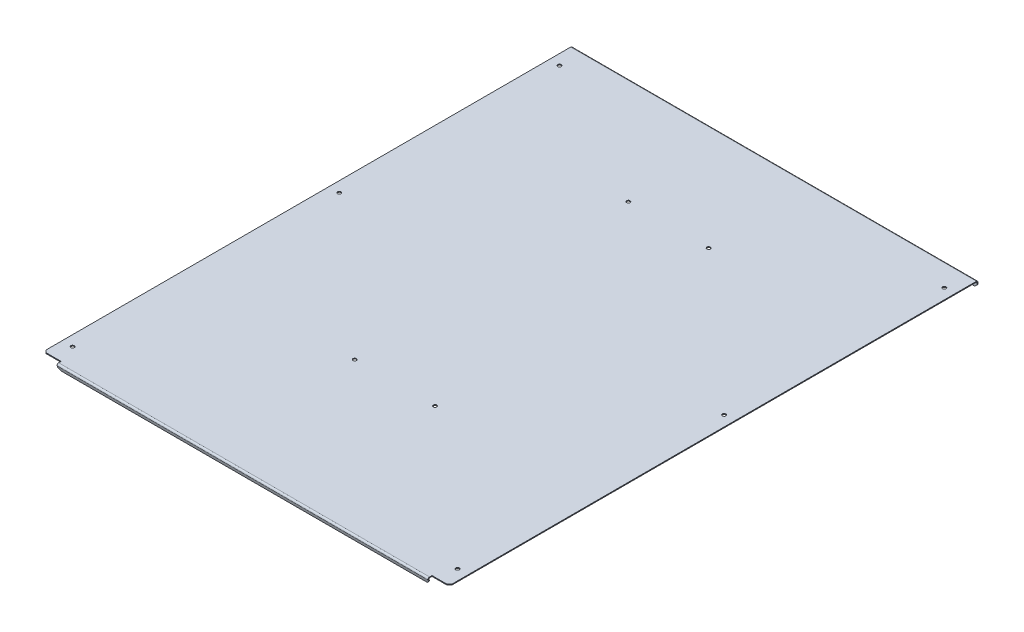
from build123d import *

# Parameters (mm, degrees)
SKETCH2_W            = 444.5
SKETCH2_H            = 584.2
BOSS_EXTRUDE1_DEPTH  = 6.35
MOVE_START           = -2.17182791
MOVE_FACE1_OUTLINE_W = 448
MOVE_FACE1_OUTLINE_H = 9
MOVE_FACE1_DEPTH     = 2.17182791
CONVERT_SOLID1_START = -222.25
CONVERT_SOLID1_DEPTH = 444.5
SKETCH7_W            = 19.05
SKETCH7_H            = 5.08
CUT_EXTRUDE1_DEPTH   = 626.080014878
SKETCH9_R            = 1.905
CUT_EXTRUDE2_DEPTH   = 1.2192
CHAMFER1_SIZE        = 2.54


# Read off the part's stored shape, not the designer's step: Move Face1, Convert-Solid1
with BuildPart() as part:
    # Sketch2 → Boss-Extrude1 (new body)
    with BuildSketch(Plane(origin=(0, 0, 0), x_dir=(1, 0, 0), z_dir=(0, 1, 0))):
        with Locations((0, 292.1)):
            Rectangle(SKETCH2_W, SKETCH2_H)
    extrude(amount=-BOSS_EXTRUDE1_DEPTH)

    # Move Face1 outline → Move Face1 (cut)
    with BuildSketch(Plane(origin=(0, 0, 0), x_dir=(1, 0, 0), z_dir=(0, 0.3420201433256691, -0.9396926207859083)).offset(MOVE_START)):
        with Locations((0, 3.5)):
            Rectangle(MOVE_FACE1_OUTLINE_W, MOVE_FACE1_OUTLINE_H)
    extrude(amount=MOVE_FACE1_DEPTH, mode=Mode.SUBTRACT)

    # Convert-Solid1 outline → Convert-Solid1 (cut)
    with BuildSketch(Plane.YZ.offset(CONVERT_SOLID1_START)):
        with BuildLine():
            Line((-6.037256781, -3.17046592), (-6.35, -2.311210988))
            Line((-6.35, -2.311210988), (-6.35, -583.2856))
            Line((-6.35, -583.2856), (-1.6764, -583.2856))
            ThreePointArc((-1.6764, -583.2856), (-1.137584633, -583.062415367), (-0.9144, -582.5236))
            Line((-0.9144, -582.5236), (-0.9144, -2.394147319))
            ThreePointArc((-0.9144, -2.394147319), (-1.239334756, -1.769953461), (-1.937019349, -1.678101541))
            Line((-1.937019349, -1.678101541), (-6.037256781, -3.17046592))
        make_face()
        with BuildLine():
            Line((0, 0), (-2.249762568, -0.818846609))
            ThreePointArc((-2.249762568, -0.818846609), (-0.714856462, -1.020920831), (0, -2.394147319))
            Line((0, -2.394147319), (0, 0))
        make_face()
        with BuildLine():
            Line((0, -584.2), (0, -582.5236))
            ThreePointArc((0, -582.5236), (-0.491006192, -583.708993808), (-1.6764, -584.2))
            Line((-1.6764, -584.2), (0, -584.2))
        make_face()
    extrude(amount=CONVERT_SOLID1_DEPTH, mode=Mode.SUBTRACT)

    # Sketch7 → Cut-Extrude1 (cut, through all)
    with BuildSketch(Plane(origin=(0, 0, 0), x_dir=(1, 0, 0), z_dir=(0, 1, 0))):
        with Locations((-212.725, 2.54)):
            Rectangle(SKETCH7_W, SKETCH7_H)
        with Locations((212.725, 2.54)):
            Rectangle(SKETCH7_W, SKETCH7_H)
    extrude(amount=-CUT_EXTRUDE1_DEPTH, mode=Mode.SUBTRACT)

    # Sketch9 → Cut-Extrude2 (cut)
    with BuildSketch(Plane(origin=(0, 0, 0), x_dir=(1, 0, 0), z_dir=(0, 1, 0))):
        with Locations(Location((-210.82, 25.4, 0), (0, 0, 270))):
            Circle(SKETCH9_R)
        with Locations(Location((-210.82, 317.5, 0), (0, 0, 270))):
            Circle(SKETCH9_R)
        with Locations(Location((-210.82, 558.8, 0), (0, 0, 270))):
            Circle(SKETCH9_R)
        with Locations(Location((210.82, 558.8, 0), (0, 0, 90))):
            Circle(SKETCH9_R)
        with Locations(Location((210.82, 317.5, 0), (0, 0, 90))):
            Circle(SKETCH9_R)
        with Locations(Location((210.82, 25.4, 0), (0, 0, 90))):
            Circle(SKETCH9_R)
        with Locations(Location((-44.0182, 167.64, 0), (0, 0, 90))):
            Circle(SKETCH9_R)
        with Locations(Location((-44.0182, 467.36, 0), (0, 0, 270))):
            Circle(SKETCH9_R)
        with Locations(Location((44.0182, 467.36, 0), (0, 0, 90))):
            Circle(SKETCH9_R)
        with Locations(Location((44.0182, 167.64, 0), (0, 0, 270))):
            Circle(SKETCH9_R)
    extrude(amount=-CUT_EXTRUDE2_DEPTH, mode=Mode.SUBTRACT)

    # Chamfer1
    chamfer1_edges = [part.edges().sort_by_distance(p)[0] for p in [
        (-222.25, -6.35, -583.7428),
        (222.25, -6.35, -583.7428),
        (-222.25, -0.4572, -5.08),
        (-203.2, -6.193628391, -2.740838454),
        (222.25, -0.4572, -5.08),
        (203.2, -6.193628391, -2.740838454),
    ]]
    chamfer(chamfer1_edges, length=CHAMFER1_SIZE)


solid = part.part
